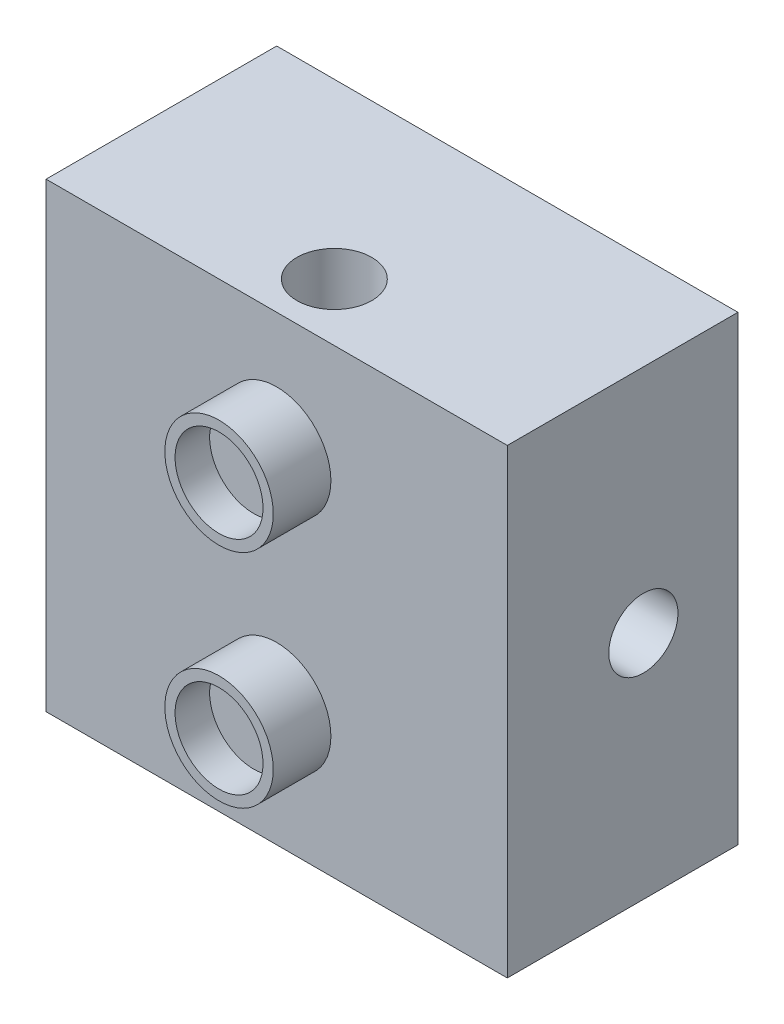
from build123d import *

# Parameters (mm, degrees)
SKETCH1_W           = 101.6
SKETCH1_H           = 101.6
BOSS_EXTRUDE1_DEPTH = 50.8
SKETCH2_R           = 8.255
CUT_EXTRUDE1_DEPTH  = 254
SKETCH3_R           = 7.62
CUT_EXTRUDE2_DEPTH  = 254
SKETCH4_R           = 11.941449671
BOSS_EXTRUDE2_DEPTH = 12.7
SKETCH5_R           = 9.688677572
CUT_EXTRUDE3_DEPTH  = 7.62


with BuildPart() as part:
    # Sketch1 → Boss-Extrude1 (new body)
    with BuildSketch(Plane.XY):
        Rectangle(SKETCH1_W, SKETCH1_H)
    extrude(amount=BOSS_EXTRUDE1_DEPTH)

    # Sketch2 → Cut-Extrude1 (cut)
    with BuildSketch(Plane(origin=(0, 50.8, 0), x_dir=(1, 0, 0), z_dir=(0, 1, 0))):
        with Locations((0, -38.1)):
            Circle(SKETCH2_R)
    extrude(amount=-CUT_EXTRUDE1_DEPTH, mode=Mode.SUBTRACT)

    # Sketch3 → Cut-Extrude2 (cut)
    with BuildSketch(Plane(origin=(50.8, 0, 0), x_dir=(0, 0, -1), z_dir=(1, 0, 0))):
        with Locations((-20.828, 0)):
            Circle(SKETCH3_R)
    extrude(amount=-CUT_EXTRUDE2_DEPTH, mode=Mode.SUBTRACT)

    # Sketch4 → Boss-Extrude2 (add)
    with BuildSketch(Plane.XY.offset(50.8)):
        with Locations((0, 24.639024532)):
            Circle(SKETCH4_R)
        with Locations((0, -24.123803476)):
            Circle(SKETCH4_R)
    extrude(amount=BOSS_EXTRUDE2_DEPTH)

    # Sketch5 → Cut-Extrude3 (cut)
    with BuildSketch(Plane.XY.offset(63.5)):
        with Locations((0, 24.639024532)):
            Circle(SKETCH5_R)
        with Locations((0, -24.123803476)):
            Circle(SKETCH5_R)
    extrude(amount=-CUT_EXTRUDE3_DEPTH, mode=Mode.SUBTRACT)


solid = part.part
